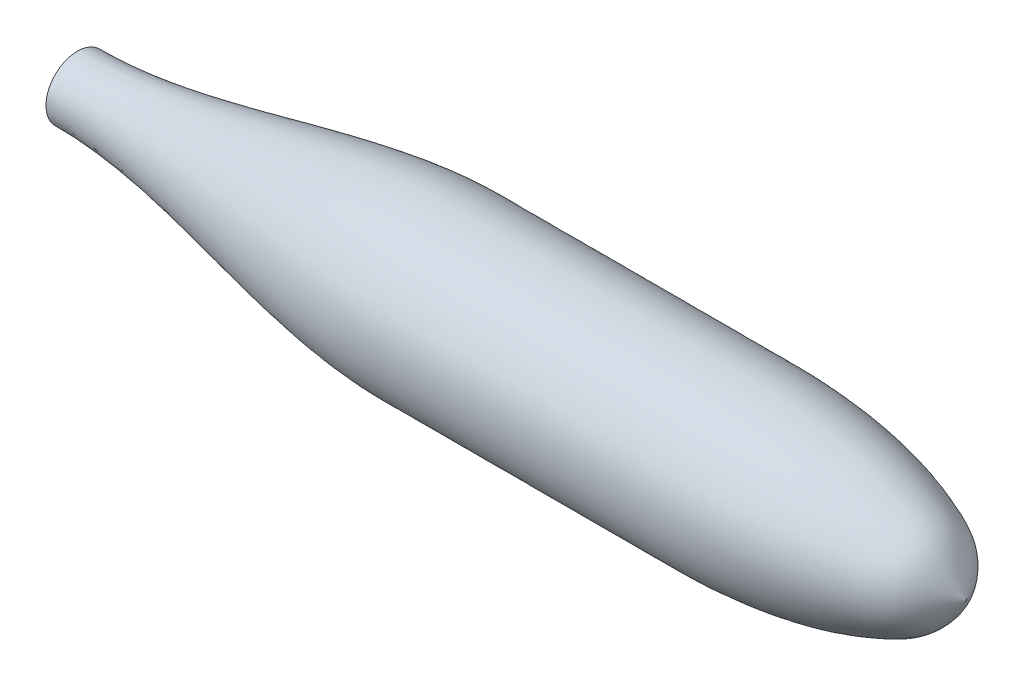
from build123d import *


with BuildPart() as part:
    # Sketch1 → Revolve1 (revolve)
    with BuildSketch(Plane.XY):
        with BuildLine():
            Line((-850, 30), (-850, 0))
            Line((-850, 0), (0, 0))
            add(Edge.make_bspline(
                [(0, 0), (-7.929095769, 14.787959135), (-21.056348163, 39.270608563), (-56.188912845, 53.725226852), (-84.556451988, 63.578239636), (-113.161421628, 70.238504778), (-141.549792733, 75.019027983), (-169.940682046, 78.127870553), (-198.309244401, 79.874688138), (-226.667177997, 80.033549718), (-254.999624579, 79.991009516), (-283.333434045, 80.002413555), (-311.666639242, 79.999336266), (-340.000008989, 80.000241381), (-368.333324803, 79.99969821), (-396.666691799, 80.00096578), (-424.999908002, 79.996438671), (-453.333676195, 80.013279535), (-481.665472085, 79.950443002), (-510.019029931, 80.185066109), (-538.398078021, 78.583889207), (-566.745475726, 75.440874119), (-595.074088661, 71.085767888), (-623.38795399, 65.835566996), (-651.693064239, 60.008361684), (-679.994254657, 53.920880531), (-708.296277754, 47.888456001), (-736.603911703, 42.230956943), (-764.922239911, 37.252086972), (-793.25710851, 33.31877368), (-821.61393571, 30.569896586), (-840.549285687, 30.18973852), (-850, 30)],
                knots=[0, 0, 0, 0, 0.054983525, 0.091029624, 0.124985921, 0.15806946, 0.190695605, 0.223063559, 0.255291545, 0.287464395, 0.319634214, 0.351804033, 0.383973852, 0.416143671, 0.448313491, 0.48048331, 0.512653129, 0.544822948, 0.576992767, 0.609162876, 0.641380662, 0.673740387, 0.706278608, 0.738985512, 0.771817756, 0.804710777, 0.837590557, 0.870385097, 0.903035956, 0.935510187, 0.967812858, 1, 1, 1, 1], degree=3))
        make_face()
    revolve(axis=Axis((50, 0, 0), (-1, 0, 0)))


solid = part.part
